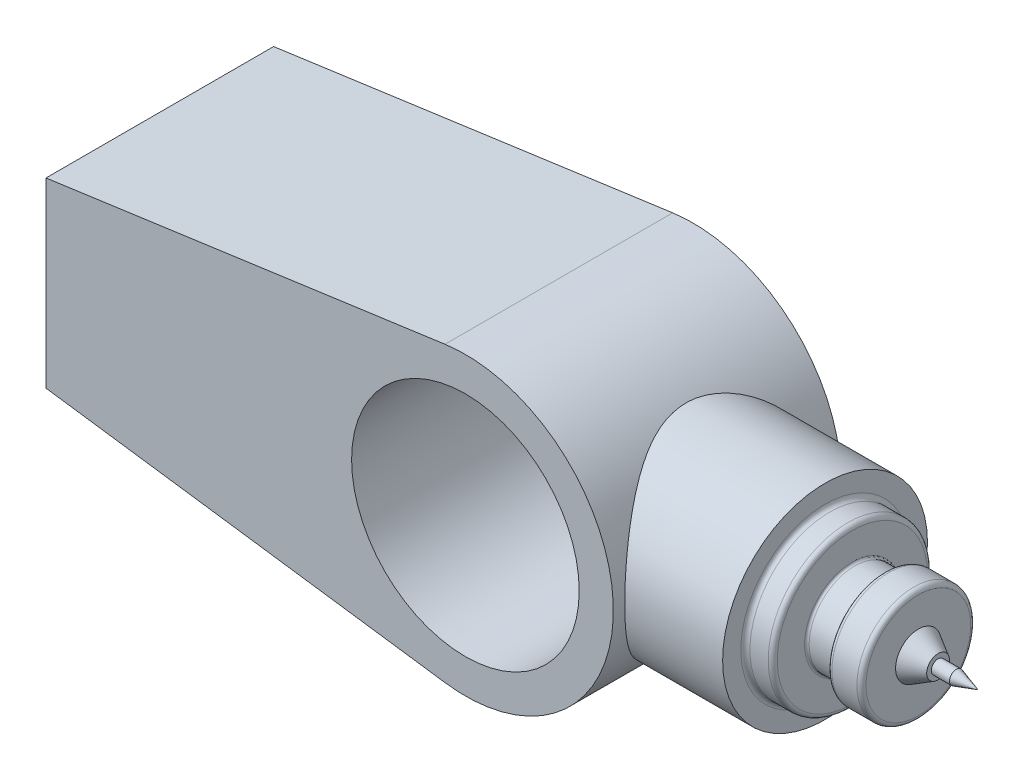
from build123d import *

# Parameters (mm, degrees)
SKETCH1_R           = 50
BOSS_EXTRUDE1_DEPTH = 50
BOSS_EXTRUDE2_REACH = 317.114
SKETCH2_R           = 45
SKETCH4_R           = 45
SKETCH4_R_2         = 35
CUT_EXTRUDE2_DEPTH  = 12
FILLET1_R           = 2
FILLET2_R           = 1


with BuildPart() as part:
    # Sketch1 → Boss-Extrude1 (new, symmetric)
    with BuildSketch(Plane.XY):
        with BuildLine():
            Line((-184.256419232, 40), (-184.256419232, -40))
            Line((-184.256419232, -40), (-8.953748927, -64.380357099))
            ThreePointArc((-8.953748927, -64.380357099), (65, 0), (-8.953748927, 64.380357099))
            Line((-8.953748927, 64.380357099), (-184.256419232, 40))
        make_face()
        Circle(SKETCH1_R, mode=Mode.SUBTRACT)
    extrude(amount=BOSS_EXTRUDE1_DEPTH, both=True)

    # Sketch2 → Boss-Extrude2 (add, up to next)
    with BuildSketch(Plane(origin=(120, 0, 0), x_dir=(0, 0, -1), z_dir=(1, 0, 0)), mode=Mode.PRIVATE) as boss_extrude2_sk1:
        Circle(SKETCH2_R)
    boss_extrude2_tool1 = extrude(boss_extrude2_sk1.sketch, amount=-BOSS_EXTRUDE2_REACH, mode=Mode.PRIVATE) - part.part
    add(boss_extrude2_tool1.solids().sort_by_distance((120, 0, 0))[0])

    # Sketch3 → Revolve1 (revolve)
    with BuildSketch(Plane.XY):
        Polygon((120, 0), (120, -20), (134, -20), (134, -25), (149, -25), (149, -10), (157.660254038, -5), (157.660254038, -3), (165.660254038, -3), (175.199646052, 0), align=None)
    revolve(axis=Axis((0, 0, 0), (1, 0, 0)))

    # Sketch4 → Cut-Extrude2 (cut)
    with BuildSketch(Plane(origin=(120, 0, 0), x_dir=(0, 0, -1), z_dir=(1, 0, 0))):
        Circle(SKETCH4_R)
        Circle(SKETCH4_R_2, mode=Mode.SUBTRACT)
    extrude(amount=-CUT_EXTRUDE2_DEPTH, mode=Mode.SUBTRACT)

    # Fillet1
    fillet1_edges = [part.edges().sort_by_distance(p)[0] for p in [
        (120, 0, 35),
        (108, 0, 35),
        (149, 25, 0),
        (134, 25, 0),
    ]]
    fillet(fillet1_edges, radius=FILLET1_R)

    # Fillet2
    fillet2_edges = [part.edges().sort_by_distance(p)[0] for p in [
        (120, 20, 0),
        (134, 20, 0),
    ]]
    fillet(fillet2_edges, radius=FILLET2_R)


solid = part.part
